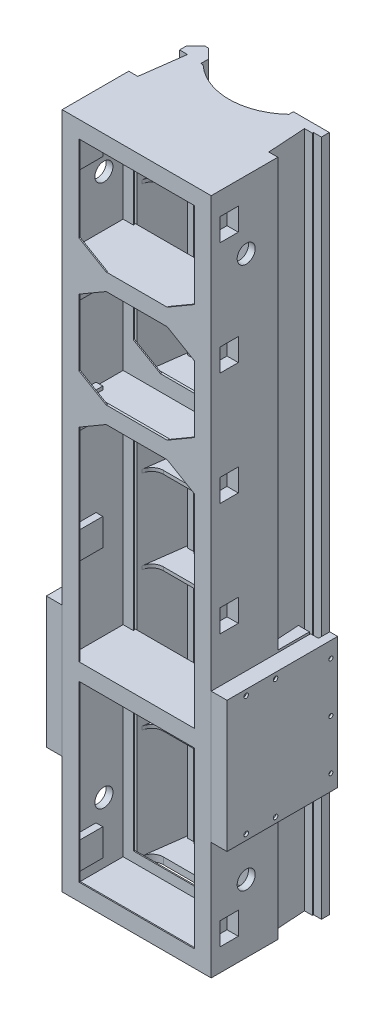
from build123d import *

# Parameters (mm, degrees)
EXTRUDE_1_DEPTH         = 3000
SHELL_START             = -2970
SHELL_4_DEPTH           = 2940
SKETCH_3_W              = 65
SKETCH_3_H              = 90
EXTRUDE_8_DEPTH         = 65
SKETCH_3_7_W            = 60
SKETCH_3_7_H            = 90
EXTRUDE_9_DEPTH         = 58
SKETCH_3_8_W            = 110
SKETCH_3_8_H            = 90
EXTRUDE_10_DEPTH        = 35
PATTERN_LINEAR_3_COUNT  = 2
PATTERN_LINEAR_3_PITCH  = 1910
CUT_EXTRUDE_START       = -60
CUT_EXTRUDE_2_DEPTH     = 60
CUT_EXTRUDE_3_DEPTH     = 1910
EXTRUDE_START           = -1890
EXTRUDE_11_DEPTH        = 610
EXTRUDE_START_2         = -1900
EXTRUDE_12_DEPTH        = 580
EXTRUDE_12_2_DEPTH      = 580
RIB_START               = -7.5
RIB_1_DEPTH             = 15
PATTERN_LINEAR_21_COUNT = 5
PATTERN_LINEAR_21_PITCH = 370
PATTERN_LINEAR_22_COUNT = 2
PATTERN_LINEAR_22_PITCH = 2095
CUT_EXTRUDE_START_2     = -10
CUT_EXTRUDE_5_DEPTH     = 560
SKETCH_15_W             = 600
SKETCH_15_H             = 2940
SKETCH_15_W_2           = 510
SKETCH_15_H_2           = 450
SKETCH_15_H_3           = 435
SKETCH_15_H_4           = 770
SKETCH_15_H_5           = 970
EXTRUDE_14_DEPTH        = 5
EXTRUDE_15_DEPTH        = 5
EXTRUDE_15_2_DEPTH      = 5
EXTRUDE_15_3_DEPTH      = 5
EXTRUDE_15_4_DEPTH      = 5
EXTRUDE_15_5_DEPTH      = 5
EXTRUDE_15_6_DEPTH      = 5
EXTRUDE_15_7_DEPTH      = 5
EXTRUDE_15_8_DEPTH      = 5
EXTRUDE_17_DEPTH        = 75
EXTRUDE_START_3         = -1045
EXTRUDE_18_DEPTH        = 75
EXTRUDE_START_4         = -1555
EXTRUDE_20_DEPTH        = 75
SKETCH_18_W             = 600
SKETCH_18_H             = 235
CUT_EXTRUDE_6_DEPTH     = 70
CUT_EXTRUDE_START_3     = -1120
SKETCH_18_2_W           = 600
SKETCH_18_2_H           = 235
CUT_EXTRUDE_7_DEPTH     = 70
CUT_EXTRUDE_START_4     = -1555
SKETCH_18_3_W           = 600
SKETCH_18_3_H           = 235
CUT_EXTRUDE_8_DEPTH     = 70
EXTRUDE_START_5         = -245
SKETCH_15_8_W           = 600
SKETCH_15_8_H           = 2940
SKETCH_15_8_W_2         = 510
SKETCH_15_8_H_2         = 450
SKETCH_15_8_H_3         = 435
SKETCH_15_8_H_4         = 770
SKETCH_15_8_H_5         = 970
EXTRUDE_22_DEPTH        = 5
EXTRUDE_23_DEPTH        = 3000
SKETCH_26_2_W           = 100
SKETCH_26_2_H           = 120
SKETCH_26_2_W_2         = 80
SKETCH_26_2_H_2         = 100
EXTRUDE_24_DEPTH        = 60
SKETCH_26_4_W           = 80
SKETCH_26_4_H           = 100
CUT_EXTRUDE_11_DEPTH    = 50
SKETCH_27_R             = 40
CUT_EXTRUDE_12_DEPTH    = 30
SKETCH_28_W             = 100
SKETCH_28_H             = 120
SKETCH_28_W_2           = 80
SKETCH_28_H_2           = 100
EXTRUDE_25_DEPTH        = 60
SKETCH_28_4_W           = 80
SKETCH_28_4_H           = 100
CUT_EXTRUDE_14_DEPTH    = 50
CUT_EXTRUDE_START_5     = -50
SKETCH_29_R             = 40
CUT_EXTRUDE_15_DEPTH    = 50
CUT_EXTRUDE_START_6     = -70
SKETCH_33_R             = 9
SKETCH_33_R_2           = 10
CUT_EXTRUDE_16_DEPTH    = 70
SKETCH_32_R             = 9
SKETCH_32_R_2           = 10
CUT_EXTRUDE_18_DEPTH    = 35
SKETCH_34_R             = 7.5
SKETCH_34_R_2           = 5
CUT_EXTRUDE_19_DEPTH    = 15
PATTERN_LINEAR_23_COUNT = 2
PATTERN_LINEAR_23_PITCH = 1910
CUT_EXTRUDE_21_DEPTH    = 30


# Read off the part's stored shape, not the designer's step: 抽壳4, 筋1
with BuildPart() as part:
    # 草图1 → 凸台-拉伸1 (new body)
    with BuildSketch(Plane(origin=(0, 0, 0), x_dir=(1, 0, 0), z_dir=(0, 1, 0))):
        with BuildLine():
            Line((330, -784.601171812), (-330, -784.601171812))
            Line((-330, -784.601171812), (-330, -489.601171812))
            Line((-330, -489.601171812), (-290, -489.601171812))
            Line((-290, -489.601171812), (-264.024386618, -295.613365121))
            Line((-264.024386618, -295.613365121), (-299.024386618, -295.613365121))
            Line((-299.024386618, -295.613365121), (-299.024386618, -265.613365121))
            Line((-299.024386618, -265.613365121), (-258.012193309, -224.601171812))
            Line((-258.012193309, -224.601171812), (-241.012193309, -224.601171812))
            Line((-241.012193309, -224.601171812), (-200, -265.613365121))
            Line((-200, -265.613365121), (-200, -300.613365121))
            Line((-200, -300.613365121), (-190, -300.613365121))
            ThreePointArc((-190, -300.613365121), (0, -375.613365121), (190, -300.613365121))
            Line((190, -300.613365121), (190, -280.668605121))
            Line((190, -280.668605121), (349.131808583, -280.668605121))
            Line((349.131808583, -280.668605121), (349.131808583, -315.668605121))
            Line((349.131808583, -315.668605121), (314.131808583, -315.668605121))
            Line((314.131808583, -315.668605121), (314.131808583, -320.668605121))
            Line((314.131808583, -320.668605121), (279.131808583, -320.668605121))
            Line((279.131808583, -320.668605121), (290, -489.601171812))
            Line((290, -489.601171812), (330, -489.601171812))
            Line((330, -489.601171812), (330, -784.601171812))
        make_face()
    extrude(amount=-EXTRUDE_1_DEPTH)

    # 抽壳4 outline → 抽壳4 (cut)
    with BuildSketch(Plane(origin=(0, 0, 0), x_dir=(1, 0, 0), z_dir=(0, 1, 0)).offset(SHELL_START)):
        with BuildLine():
            Line((-230, -278.039771992), (-231.237731028, -276.802040964))
            Line((-231.237731028, -276.802040964), (-263.749343278, -519.601171812))
            Line((-263.749343278, -519.601171812), (-300, -519.601171812))
            Line((-300, -519.601171812), (-300, -784.601171812))
            Line((-300, -784.601171812), (300, -784.601171812))
            Line((300, -784.601171812), (300, -519.601171812))
            Line((300, -519.601171812), (261.868015057, -519.601171812))
            Line((261.868015057, -519.601171812), (248.426443829, -310.668605121))
            Line((248.426443829, -310.668605121), (220, -310.668605121))
            Line((220, -310.668605121), (220, -313.239873612))
            ThreePointArc((220, -313.239873612), (12.691481562, -405.351912344), (-201.494416796, -330.613365121))
            Line((-201.494416796, -330.613365121), (-230, -330.613365121))
            Line((-230, -330.613365121), (-230, -278.039771992))
        make_face()
        Polygon((-256.597979746, -265.613365121), (-242.426406871, -265.613365121), (-249.512193309, -258.527578683), align=None)
    extrude(amount=SHELL_4_DEPTH, mode=Mode.SUBTRACT)

    # 草图3 → 凸台-拉伸8 (add)
    with BuildSketch(Plane(origin=(0, 0, 375.613365121), x_dir=(-1, 0, 0), z_dir=(0, 0, -1))):
        with Locations((147.5, -1045)):
            Rectangle(SKETCH_3_W, SKETCH_3_H)
        with Locations((-147.5, -1045)):
            Rectangle(SKETCH_3_W, SKETCH_3_H)
    extrude_8 = extrude(amount=EXTRUDE_8_DEPTH)

    # 草图3<7> → 凸台-拉伸9 (add)
    with BuildSketch(Plane(origin=(0, 0, 375.613365121), x_dir=(-1, 0, 0), z_dir=(0, 0, -1))):
        with Locations((85, -1045)):
            Rectangle(SKETCH_3_7_W, SKETCH_3_7_H)
        with Locations((-85, -1045)):
            Rectangle(SKETCH_3_7_W, SKETCH_3_7_H)
    extrude_9 = extrude(amount=EXTRUDE_9_DEPTH)

    # 草图3<8> → 凸台-拉伸10 (add)
    with BuildSketch(Plane(origin=(0, 0, 375.613365121), x_dir=(-1, 0, 0), z_dir=(0, 0, -1))):
        with Locations((0, -1045)):
            Rectangle(SKETCH_3_8_W, SKETCH_3_8_H)
    extrude_10 = extrude(amount=EXTRUDE_10_DEPTH)

    # 阵列(线性)3: 凸台-拉伸8, 凸台-拉伸9, 凸台-拉伸10 ×2
    with Locations(*[(0, -i * PATTERN_LINEAR_3_PITCH, 0) for i in range(1, PATTERN_LINEAR_3_COUNT)]):
        add(extrude_8)
        add(extrude_9)
        add(extrude_10)

    # 草图6 → 切除-拉伸2 (cut)
    with BuildSketch(Plane(origin=(0, -2910, 0), x_dir=(1, 0, 0), z_dir=(0, 1, 0)).offset(CUT_EXTRUDE_START)):
        with BuildLine():
            Line((180, -375.613365121), (180, -347.580051777))
            ThreePointArc((180, -347.580051777), (156.940827782, -362.656560676), (132.627297341, -375.613365121))
            Line((132.627297341, -375.613365121), (180, -375.613365121))
        make_face()
        with BuildLine():
            Line((-180, -347.580051777), (-180, -375.613365121))
            Line((-180, -375.613365121), (-132.627297341, -375.613365121))
            ThreePointArc((-132.627297341, -375.613365121), (-156.940827782, -362.656560676), (-180, -347.580051777))
        make_face()
    extrude(amount=CUT_EXTRUDE_2_DEPTH, mode=Mode.SUBTRACT)

    # 草图6<2> → 切除-拉伸3 (cut)
    with BuildSketch(Plane(origin=(0, -2910, 0), x_dir=(1, 0, 0), z_dir=(0, 1, 0))):
        with BuildLine():
            Line((180, -375.613365121), (180, -347.580051777))
            ThreePointArc((180, -347.580051777), (156.940827782, -362.656560676), (132.627297341, -375.613365121))
            Line((132.627297341, -375.613365121), (180, -375.613365121))
        make_face()
        with BuildLine():
            Line((-180, -347.580051777), (-180, -375.613365121))
            Line((-180, -375.613365121), (-132.627297341, -375.613365121))
            ThreePointArc((-132.627297341, -375.613365121), (-156.940827782, -362.656560676), (-180, -347.580051777))
        make_face()
    extrude(amount=CUT_EXTRUDE_3_DEPTH, mode=Mode.SUBTRACT)

    # 草图4<4> → 凸台-拉伸11 (add)
    with BuildSketch(Plane(origin=(0, 0, 0), x_dir=(1, 0, 0), z_dir=(0, 1, 0)).offset(EXTRUDE_START)):
        Polygon((290, -489.601171812), (330, -489.601171812), (330, -349.601171812), (280.993170659, -349.601171812), align=None)
        Polygon((-330, -344.601171812), (-330, -489.601171812), (-290, -489.601171812), (-270.584017085, -344.601171812), align=None)
    extrude(amount=-EXTRUDE_11_DEPTH)

    # 筋1 outline → 筋1 (add)
    with BuildSketch(Plane(origin=(0, -385, 0), x_dir=(-1, 0, 0), z_dir=(0, -1, 0)).offset(RIB_START)):
        with BuildLine():
            ThreePointArc((210.399548579, -456.127141865), (244.152556242, -468.809570895), (261.202451327, -500.580793881))
            Line((261.202451327, -500.580793881), (231.237731028, -276.802040964))
            Line((231.237731028, -276.802040964), (230, -278.039771992))
            Line((230, -278.039771992), (230, -330.613365121))
            Line((230, -330.613365121), (201.494416796, -330.613365121))
            ThreePointArc((201.494416796, -330.613365121), (-12.691481562, -405.351912344), (-220, -313.239873612))
            Line((-220, -313.239873612), (-220, -310.668605121))
            Line((-220, -310.668605121), (-248.426443829, -310.668605121))
            Line((-248.426443829, -310.668605121), (-260.792596978, -502.88513053))
            ThreePointArc((-260.792596978, -502.88513053), (-245.108034132, -469.645289912), (-210.929792672, -456.127141865))
            Line((-210.929792672, -456.127141865), (210.399548579, -456.127141865))
        make_face()
    rib_1 = extrude(amount=RIB_1_DEPTH)

    # 阵列(线性)21: 筋1 ×5
    with Locations(*[(0, -i * PATTERN_LINEAR_21_PITCH, 0) for i in range(1, PATTERN_LINEAR_21_COUNT)]):
        add(rib_1)

    # 阵列(线性)22: 筋1 ×2
    with Locations(*[(0, -i * PATTERN_LINEAR_22_PITCH, 0) for i in range(1, PATTERN_LINEAR_22_COUNT)]):
        add(rib_1)

    # 草图15 → 凸台-拉伸14 (add)
    with BuildSketch(Plane.XY.offset(784.601171812)):
        with Locations((0, -1500)):
            Rectangle(SKETCH_15_W, SKETCH_15_H)
        with Locations((0, -300)):
            Rectangle(SKETCH_15_W_2, SKETCH_15_H_2, mode=Mode.SUBTRACT)
        with Locations((0, -817.5)):
            Rectangle(SKETCH_15_W_2, SKETCH_15_H_3, mode=Mode.SUBTRACT)
        with Locations((0, -2540)):
            Rectangle(SKETCH_15_W_2, SKETCH_15_H_4, mode=Mode.SUBTRACT)
        with Locations((0, -1595)):
            Rectangle(SKETCH_15_W_2, SKETCH_15_H_5, mode=Mode.SUBTRACT)
    extrude(amount=-EXTRUDE_14_DEPTH)

    # 草图17 → 凸台-拉伸17 (add)
    with BuildSketch(Plane.XZ.offset(2155)):
        Polygon((-255, 784.601171812), (-255, 779.601171812), (-300, 779.601171812), (-300, 534.601171812), (300, 534.601171812), (300, 779.601171812), (255, 779.601171812), (255, 784.601171812), align=None)
    extrude(amount=-EXTRUDE_17_DEPTH)



with BuildPart() as body_2:
    # 草图4 → 凸台-拉伸12 (new body)
    with BuildSketch(Plane(origin=(0, 0, 0), x_dir=(1, 0, 0), z_dir=(0, 1, 0)).offset(EXTRUDE_START_2)):
        Polygon((330, -784.601171812), (400, -784.601171812), (400, -294.601171812), (365, -294.601171812), (365, -344.601171812), (330, -344.601171812), align=None)
    extrude(amount=-EXTRUDE_12_DEPTH)


with BuildPart() as body_3:
    # 草图4 → Extrude 12 2 (new body)
    with BuildSketch(Plane(origin=(0, 0, 0), x_dir=(1, 0, 0), z_dir=(0, 1, 0)).offset(EXTRUDE_START_2)):
        Polygon((-330, -784.601171812), (-330, -344.601171812), (-365, -344.601171812), (-365, -294.601171812), (-400, -294.601171812), (-400, -784.601171812), align=None)
    extrude(amount=-EXTRUDE_12_2_DEPTH)


with BuildPart() as cut_extrude_5_tool:
    # 草图14 → 切除-拉伸5 (new body)
    with BuildSketch(Plane(origin=(0, -1900, 0), x_dir=(1, 0, 0), z_dir=(0, 1, 0)).offset(CUT_EXTRUDE_START_2)):
        Polygon((340, -354.601171812), (375, -354.601171812), (375, -304.601171812), (390, -304.601171812), (390, -774.601171812), (340, -774.601171812), align=None)
        Polygon((-390, -774.601171812), (-340, -774.601171812), (-340, -354.601171812), (-375, -354.601171812), (-375, -304.601171812), (-390, -304.601171812), align=None)
    extrude(amount=-CUT_EXTRUDE_5_DEPTH)


with BuildPart() as body_2_1:
    add(body_2.part)

    # 切除-拉伸5: cut by cut_extrude_5_tool
    add(cut_extrude_5_tool.part, mode=Mode.SUBTRACT)

    # 草图32 → 切除-拉伸18 (cut)
    with BuildSketch(Plane(origin=(400, 0, 0), x_dir=(0, 0, -1), z_dir=(1, 0, 0))):
        with Locations((-324.601171812, -2410)):
            Circle(SKETCH_32_R)
        with Locations((-324.601171812, -2190)):
            Circle(SKETCH_32_R)
        with Locations((-324.601171812, -1970)):
            Circle(SKETCH_32_R)
        with Locations((-699.601171812, -2455)):
            Circle(SKETCH_32_R_2)
        with Locations((-699.601171812, -1925)):
            Circle(SKETCH_32_R_2)
        with Locations((-569.601171812, -1925)):
            Circle(SKETCH_32_R_2)
        with Locations((-569.601171812, -2455)):
            Circle(SKETCH_32_R_2)
    extrude(amount=-CUT_EXTRUDE_18_DEPTH, mode=Mode.SUBTRACT)


with BuildPart() as body_3_1:
    add(body_3.part)

    # 切除-拉伸5: cut by cut_extrude_5_tool
    add(cut_extrude_5_tool.part, mode=Mode.SUBTRACT)

    # 草图33 → 切除-拉伸16 (cut)
    with BuildSketch(Plane.ZY.offset(400).offset(CUT_EXTRUDE_START_6)):
        with Locations((324.601171812, -1970)):
            Circle(SKETCH_33_R)
        with Locations((324.601171812, -2190)):
            Circle(SKETCH_33_R)
        with Locations((324.601171812, -2410)):
            Circle(SKETCH_33_R)
        with Locations((699.601171812, -2455)):
            Circle(SKETCH_33_R_2)
        with Locations((569.601171812, -2455)):
            Circle(SKETCH_33_R_2)
        with Locations((569.601171812, -1925)):
            Circle(SKETCH_33_R_2)
        with Locations((699.601171812, -1925)):
            Circle(SKETCH_33_R_2)
    extrude(amount=CUT_EXTRUDE_16_DEPTH, mode=Mode.SUBTRACT)


with BuildPart() as body_4:
    # 草图15<3> → 凸台-拉伸15 (new body)
    with BuildSketch(Plane.XY.offset(784.601171812)):
        Polygon((-135, -1110), (-255, -1110), (-255, -1180), align=None)
    extrude(amount=-EXTRUDE_15_DEPTH)


with BuildPart() as body_5:
    # 草图15<3> → Extrude 15 2 (new body)
    with BuildSketch(Plane.XY.offset(784.601171812)):
        Polygon((-255, -965), (-255, -1035), (-135, -1035), align=None)
    extrude(amount=-EXTRUDE_15_2_DEPTH)


with BuildPart() as body_6:
    # 草图15<3> → Extrude 15 3 (new body)
    with BuildSketch(Plane.XY.offset(784.601171812)):
        Polygon((255, -965), (135, -1035), (255, -1035), align=None)
    extrude(amount=-EXTRUDE_15_3_DEPTH)


with BuildPart() as body_7:
    # 草图15<3> → Extrude 15 4 (new body)
    with BuildSketch(Plane.XY.offset(784.601171812)):
        Polygon((255, -1110), (135, -1110), (255, -1180), align=None)
    extrude(amount=-EXTRUDE_15_4_DEPTH)


with BuildPart() as body_8:
    # 草图15<3> → Extrude 15 5 (new body)
    with BuildSketch(Plane.XY.offset(784.601171812)):
        Polygon((135, -600), (255, -670), (255, -600), align=None)
    extrude(amount=-EXTRUDE_15_5_DEPTH)


with BuildPart() as body_9:
    # 草图15<3> → Extrude 15 6 (new body)
    with BuildSketch(Plane.XY.offset(784.601171812)):
        Polygon((255, -455), (135, -525), (255, -525), align=None)
    extrude(amount=-EXTRUDE_15_6_DEPTH)


with BuildPart() as body_10:
    # 草图15<3> → Extrude 15 7 (new body)
    with BuildSketch(Plane.XY.offset(784.601171812)):
        Polygon((-135, -525), (-255, -455), (-255, -525), align=None)
    extrude(amount=-EXTRUDE_15_7_DEPTH)


with BuildPart() as body_11:
    # 草图15<3> → Extrude 15 8 (new body)
    with BuildSketch(Plane.XY.offset(784.601171812)):
        Polygon((-255, -600), (-255, -670), (-135, -600), align=None)
    extrude(amount=-EXTRUDE_15_8_DEPTH)


with BuildPart() as part_1:
    add(part.part)

    add(body_4.part)  # 凸台-拉伸18 merges body 4

    add(body_5.part)  # 凸台-拉伸18 merges body 5

    add(body_6.part)  # 凸台-拉伸18 merges body 6

    add(body_7.part)  # 凸台-拉伸18 merges body 7
    # 草图17<2> → 凸台-拉伸18 (add)
    with BuildSketch(Plane.XZ.offset(2155).offset(EXTRUDE_START_3)):
        Polygon((-255, 784.601171812), (-255, 779.601171812), (-300, 779.601171812), (-300, 534.601171812), (300, 534.601171812), (300, 779.601171812), (255, 779.601171812), (255, 784.601171812), align=None)
    extrude(amount=-EXTRUDE_18_DEPTH)


    add(body_8.part)  # 凸台-拉伸20 merges body 8

    add(body_9.part)  # 凸台-拉伸20 merges body 9

    add(body_10.part)  # 凸台-拉伸20 merges body 10

    add(body_11.part)  # 凸台-拉伸20 merges body 11
    # 草图17<5> → 凸台-拉伸20 (add)
    with BuildSketch(Plane.XZ.offset(2155).offset(EXTRUDE_START_4)):
        Polygon((-255, 784.601171812), (-255, 779.601171812), (-300, 779.601171812), (-300, 534.601171812), (300, 534.601171812), (300, 779.601171812), (255, 779.601171812), (255, 784.601171812), align=None)
    extrude(amount=-EXTRUDE_20_DEPTH)

    # 草图18 → 切除-拉伸6 (cut)
    with BuildSketch(Plane.XZ.offset(2155)):
        with Locations((0, 657.101171812)):
            Rectangle(SKETCH_18_W, SKETCH_18_H)
    extrude(amount=-CUT_EXTRUDE_6_DEPTH, mode=Mode.SUBTRACT)

    # 草图18<2> → 切除-拉伸7 (cut)
    with BuildSketch(Plane.XZ.offset(2155).offset(CUT_EXTRUDE_START_3)):
        with Locations((0, 657.101171812)):
            Rectangle(SKETCH_18_2_W, SKETCH_18_2_H)
    extrude(amount=CUT_EXTRUDE_7_DEPTH, mode=Mode.SUBTRACT)

    # 草图18<3> → 切除-拉伸8 (cut)
    with BuildSketch(Plane.XZ.offset(2155).offset(CUT_EXTRUDE_START_4)):
        with Locations((0, 657.101171812)):
            Rectangle(SKETCH_18_3_W, SKETCH_18_3_H)
    extrude(amount=-CUT_EXTRUDE_8_DEPTH, mode=Mode.SUBTRACT)

    # 草图15<8> → 凸台-拉伸22 (add)
    # profile 1 of 5: a face of its own
    with BuildSketch(Plane.XY.offset(784.601171812).offset(EXTRUDE_START_5)):
        with Locations((0, -1500)):
            Rectangle(SKETCH_15_8_W, SKETCH_15_8_H)
        with Locations((0, -300)):
            Rectangle(SKETCH_15_8_W_2, SKETCH_15_8_H_2, mode=Mode.SUBTRACT)
        with Locations((0, -817.5)):
            Rectangle(SKETCH_15_8_W_2, SKETCH_15_8_H_3, mode=Mode.SUBTRACT)
        with Locations((0, -2540)):
            Rectangle(SKETCH_15_8_W_2, SKETCH_15_8_H_4, mode=Mode.SUBTRACT)
        with Locations((0, -1595)):
            Rectangle(SKETCH_15_8_W_2, SKETCH_15_8_H_5, mode=Mode.SUBTRACT)
    # profile 2 of 5: a face of its own
    with BuildSketch(Plane.XY.offset(784.601171812).offset(EXTRUDE_START_5)):
        Polygon((-255, -600), (-255, -670), (-135, -600), align=None)
    # profile 3 of 5: a face of its own
    with BuildSketch(Plane.XY.offset(784.601171812).offset(EXTRUDE_START_5)):
        Polygon((135, -600), (255, -670), (255, -600), align=None)
    # profile 4 of 5: a face of its own
    with BuildSketch(Plane.XY.offset(784.601171812).offset(EXTRUDE_START_5)):
        Polygon((255, -965), (135, -1035), (255, -1035), align=None)
    # profile 5 of 5: a face of its own
    with BuildSketch(Plane.XY.offset(784.601171812).offset(EXTRUDE_START_5)):
        Polygon((-255, -965), (-255, -1035), (-135, -1035), align=None)
    extrude(amount=EXTRUDE_22_DEPTH)

    # 草图22 → 凸台-拉伸23 (add)
    with BuildSketch(Plane.XZ.offset(3000)):
        Polygon((-249.512193309, 258.527578683), (-256.597979746, 265.613365121), (-242.426406871, 265.613365121), align=None)
    extrude(amount=-EXTRUDE_23_DEPTH)

    # 草图26<2> → 凸台-拉伸24 (add)
    # profile 1 of 10: a face of its own
    with BuildSketch(Plane(origin=(330, 0, 0), x_dir=(0, 0, -1), z_dir=(1, 0, 0))):
        with Locations((-704.601171812, -150)):
            Rectangle(SKETCH_26_2_W, SKETCH_26_2_H)
        with Locations((-704.601171812, -150)):
            Rectangle(SKETCH_26_2_W_2, SKETCH_26_2_H_2, mode=Mode.SUBTRACT)
    # profile 2 of 10: a face of its own
    with BuildSketch(Plane(origin=(330, 0, 0), x_dir=(0, 0, -1), z_dir=(1, 0, 0))):
        with Locations((-704.601171812, -150)):
            Rectangle(SKETCH_26_2_W_2, SKETCH_26_2_H_2)
    # profile 3 of 10: a face of its own
    with BuildSketch(Plane(origin=(330, 0, 0), x_dir=(0, 0, -1), z_dir=(1, 0, 0))):
        with Locations((-704.601171812, -650)):
            Rectangle(SKETCH_26_2_W, SKETCH_26_2_H)
        with Locations((-704.601171812, -650)):
            Rectangle(SKETCH_26_2_W_2, SKETCH_26_2_H_2, mode=Mode.SUBTRACT)
    # profile 4 of 10: a face of its own
    with BuildSketch(Plane(origin=(330, 0, 0), x_dir=(0, 0, -1), z_dir=(1, 0, 0))):
        with Locations((-704.601171812, -650)):
            Rectangle(SKETCH_26_2_W_2, SKETCH_26_2_H_2)
    # profile 5 of 10: a face of its own
    with BuildSketch(Plane(origin=(330, 0, 0), x_dir=(0, 0, -1), z_dir=(1, 0, 0))):
        with Locations((-704.601171812, -1150)):
            Rectangle(SKETCH_26_2_W, SKETCH_26_2_H)
        with Locations((-704.601171812, -1150)):
            Rectangle(SKETCH_26_2_W_2, SKETCH_26_2_H_2, mode=Mode.SUBTRACT)
    # profile 6 of 10: a face of its own
    with BuildSketch(Plane(origin=(330, 0, 0), x_dir=(0, 0, -1), z_dir=(1, 0, 0))):
        with Locations((-704.601171812, -1150)):
            Rectangle(SKETCH_26_2_W_2, SKETCH_26_2_H_2)
    # profile 7 of 10: a face of its own
    with BuildSketch(Plane(origin=(330, 0, 0), x_dir=(0, 0, -1), z_dir=(1, 0, 0))):
        with Locations((-704.601171812, -1650)):
            Rectangle(SKETCH_26_2_W, SKETCH_26_2_H)
        with Locations((-704.601171812, -1650)):
            Rectangle(SKETCH_26_2_W_2, SKETCH_26_2_H_2, mode=Mode.SUBTRACT)
    # profile 8 of 10: a face of its own
    with BuildSketch(Plane(origin=(330, 0, 0), x_dir=(0, 0, -1), z_dir=(1, 0, 0))):
        with Locations((-704.601171812, -1650)):
            Rectangle(SKETCH_26_2_W_2, SKETCH_26_2_H_2)
    # profile 9 of 10: a face of its own
    with BuildSketch(Plane(origin=(330, 0, 0), x_dir=(0, 0, -1), z_dir=(1, 0, 0))):
        with Locations((-704.601171812, -2850)):
            Rectangle(SKETCH_26_2_W, SKETCH_26_2_H)
        with Locations((-704.601171812, -2850)):
            Rectangle(SKETCH_26_2_W_2, SKETCH_26_2_H_2, mode=Mode.SUBTRACT)
    # profile 10 of 10: a face of its own
    with BuildSketch(Plane(origin=(330, 0, 0), x_dir=(0, 0, -1), z_dir=(1, 0, 0))):
        with Locations((-704.601171812, -2850)):
            Rectangle(SKETCH_26_2_W_2, SKETCH_26_2_H_2)
    extrude(amount=-EXTRUDE_24_DEPTH)

    # 草图26<4> → 切除-拉伸11 (cut)
    with BuildSketch(Plane(origin=(330, 0, 0), x_dir=(0, 0, -1), z_dir=(1, 0, 0))):
        with Locations((-704.601171812, -150)):
            Rectangle(SKETCH_26_4_W, SKETCH_26_4_H)
        with Locations((-704.601171812, -650)):
            Rectangle(SKETCH_26_4_W, SKETCH_26_4_H)
        with Locations((-704.601171812, -1150)):
            Rectangle(SKETCH_26_4_W, SKETCH_26_4_H)
        with Locations((-704.601171812, -1650)):
            Rectangle(SKETCH_26_4_W, SKETCH_26_4_H)
        with Locations((-704.601171812, -2850)):
            Rectangle(SKETCH_26_4_W, SKETCH_26_4_H)
    extrude(amount=-CUT_EXTRUDE_11_DEPTH, mode=Mode.SUBTRACT)

    # 草图27 → 切除-拉伸12 (cut)
    with BuildSketch(Plane(origin=(330, 0, 0), x_dir=(0, 0, -1), z_dir=(1, 0, 0))):
        with Locations((-629.601171812, -300)):
            Circle(SKETCH_27_R)
        with Locations((-629.601171812, -2700)):
            Circle(SKETCH_27_R)
    extrude(amount=-CUT_EXTRUDE_12_DEPTH, mode=Mode.SUBTRACT)

    # 草图28 → 凸台-拉伸25 (add)
    # profile 1 of 10: a face of its own
    with BuildSketch(Plane.ZY.offset(330)):
        with Locations((714.601171812, -2840)):
            Rectangle(SKETCH_28_W, SKETCH_28_H)
        with Locations((714.601171812, -2840)):
            Rectangle(SKETCH_28_W_2, SKETCH_28_H_2, mode=Mode.SUBTRACT)
    # profile 2 of 10: a face of its own
    with BuildSketch(Plane.ZY.offset(330)):
        with Locations((714.601171812, -2840)):
            Rectangle(SKETCH_28_W_2, SKETCH_28_H_2)
    # profile 3 of 10: a face of its own
    with BuildSketch(Plane.ZY.offset(330)):
        with Locations((714.601171812, -1650)):
            Rectangle(SKETCH_28_W, SKETCH_28_H)
        with Locations((714.601171812, -1650)):
            Rectangle(SKETCH_28_W_2, SKETCH_28_H_2, mode=Mode.SUBTRACT)
    # profile 4 of 10: a face of its own
    with BuildSketch(Plane.ZY.offset(330)):
        with Locations((714.601171812, -1650)):
            Rectangle(SKETCH_28_W_2, SKETCH_28_H_2)
    # profile 5 of 10: a face of its own
    with BuildSketch(Plane.ZY.offset(330)):
        with Locations((714.601171812, -1150)):
            Rectangle(SKETCH_28_W, SKETCH_28_H)
        with Locations((714.601171812, -1150)):
            Rectangle(SKETCH_28_W_2, SKETCH_28_H_2, mode=Mode.SUBTRACT)
    # profile 6 of 10: a face of its own
    with BuildSketch(Plane.ZY.offset(330)):
        with Locations((714.601171812, -1150)):
            Rectangle(SKETCH_28_W_2, SKETCH_28_H_2)
    # profile 7 of 10: a face of its own
    with BuildSketch(Plane.ZY.offset(330)):
        with Locations((714.601171812, -650)):
            Rectangle(SKETCH_28_W, SKETCH_28_H)
        with Locations((714.601171812, -650)):
            Rectangle(SKETCH_28_W_2, SKETCH_28_H_2, mode=Mode.SUBTRACT)
    # profile 8 of 10: a face of its own
    with BuildSketch(Plane.ZY.offset(330)):
        with Locations((714.601171812, -650)):
            Rectangle(SKETCH_28_W_2, SKETCH_28_H_2)
    # profile 9 of 10: a face of its own
    with BuildSketch(Plane.ZY.offset(330)):
        with Locations((714.601171812, -150)):
            Rectangle(SKETCH_28_W, SKETCH_28_H)
        with Locations((714.601171812, -150)):
            Rectangle(SKETCH_28_W_2, SKETCH_28_H_2, mode=Mode.SUBTRACT)
    # profile 10 of 10: a face of its own
    with BuildSketch(Plane.ZY.offset(330)):
        with Locations((714.601171812, -150)):
            Rectangle(SKETCH_28_W_2, SKETCH_28_H_2)
    extrude(amount=-EXTRUDE_25_DEPTH)

    # 草图28<4> → 切除-拉伸14 (cut)
    with BuildSketch(Plane.ZY.offset(330)):
        with Locations((714.601171812, -2840)):
            Rectangle(SKETCH_28_4_W, SKETCH_28_4_H)
        with Locations((714.601171812, -1650)):
            Rectangle(SKETCH_28_4_W, SKETCH_28_4_H)
        with Locations((714.601171812, -1150)):
            Rectangle(SKETCH_28_4_W, SKETCH_28_4_H)
        with Locations((714.601171812, -650)):
            Rectangle(SKETCH_28_4_W, SKETCH_28_4_H)
        with Locations((714.601171812, -150)):
            Rectangle(SKETCH_28_4_W, SKETCH_28_4_H)
    extrude(amount=-CUT_EXTRUDE_14_DEPTH, mode=Mode.SUBTRACT)

    # 草图29 → 切除-拉伸15 (cut)
    with BuildSketch(Plane.ZY.offset(330).offset(CUT_EXTRUDE_START_5)):
        with Locations(Location((629.601171812, -300, 0), (0, 0, 180))):
            Circle(SKETCH_29_R)
        with Locations(Location((629.601171812, -2700, 0), (0, 0, 180))):
            Circle(SKETCH_29_R)
    extrude(amount=CUT_EXTRUDE_15_DEPTH, mode=Mode.SUBTRACT)

    # 草图34 → 切除-拉伸19 (cut)
    with BuildSketch(Plane(origin=(0, 0, 317.613365121), x_dir=(-1, 0, 0), z_dir=(0, 0, -1))):
        with Locations((86, -2935.5)):
            Circle(SKETCH_34_R)
        with Locations((70.5, -2953)):
            Circle(SKETCH_34_R_2)
        with Locations((86, -2974.5)):
            Circle(SKETCH_34_R)
        with Locations((-86, -2935.5)):
            Circle(SKETCH_34_R)
        with Locations((-70.5, -2953)):
            Circle(SKETCH_34_R_2)
        with Locations((-86, -2974.5)):
            Circle(SKETCH_34_R)
    cut_extrude_19 = extrude(amount=-CUT_EXTRUDE_19_DEPTH, mode=Mode.SUBTRACT)

    # 阵列(线性)23: 切除-拉伸19 ×2
    with Locations(*[(0, i * PATTERN_LINEAR_23_PITCH, 0) for i in range(1, PATTERN_LINEAR_23_COUNT)]):
        add(cut_extrude_19, mode=Mode.SUBTRACT)

    # 草图36 → 切除-拉伸21 (cut)
    with BuildSketch(Plane(origin=(0, -2970, 0), x_dir=(1, 0, 0), z_dir=(0, 1, 0))):
        with BuildLine():
            Line((-210.399548579, -456.127141865), (210.929792672, -456.127141865))
            ThreePointArc((210.929792672, -456.127141865), (245.108034132, -469.645289912), (260.792596978, -502.88513053))
            Line((260.792596978, -502.88513053), (261.868015057, -519.601171812))
            Line((261.868015057, -519.601171812), (-263.749343278, -519.601171812))
            Line((-263.749343278, -519.601171812), (-261.202451327, -500.580793881))
            ThreePointArc((-261.202451327, -500.580793881), (-244.152556242, -468.809570895), (-210.399548579, -456.127141865))
        make_face()
    extrude(amount=-CUT_EXTRUDE_21_DEPTH, mode=Mode.SUBTRACT)


solid = Compound([body_2_1.part, body_3_1.part, part_1.part])
